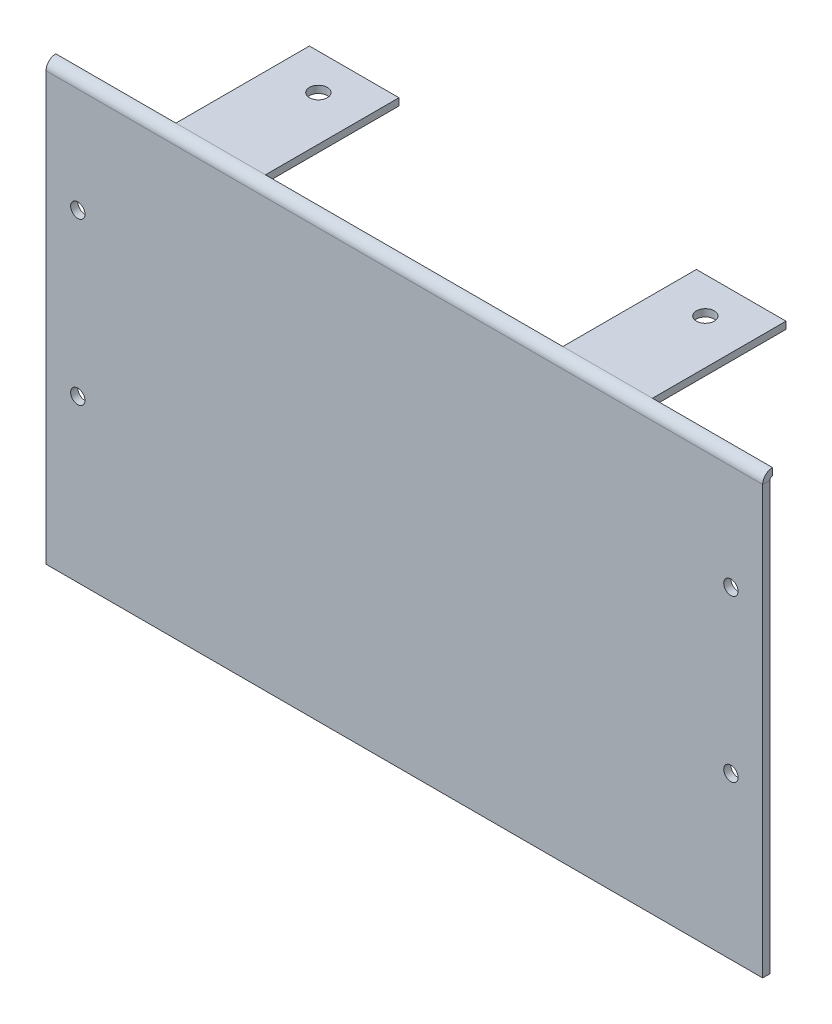
from build123d import *

# Parameters (mm, degrees)
SKETCH2_W                    = 200
SKETCH2_H                    = 120
BASE_FLANGE1_DEPTH           = 2
CUT_EXTRUDE1_REACH           = 235.247
SKETCH7_R                    = 2
EDGE_FLANGE1_STRIP_W         = 9.4732
EDGE_FLANGE1_STRIP_H         = 2
EDGE_FLANGE1_STRIP_CUT_DEPTH = 200
EDGE_FLANGE1_DEPTH           = 200
CUT_EXTRUDE2_REACH           = 239.664
SKETCH11_R                   = 2.5
SKETCH11_W                   = 33.5
SKETCH11_H                   = 37.2634
SKETCH11_W_2                 = 83


# Sheet-metal steps are written as plain solids
with BuildPart() as part:
    # Sketch2 → Base-Flange1 (new body)
    with BuildSketch(Plane.XY):
        with Locations((100, 60)):
            Rectangle(SKETCH2_W, SKETCH2_H)
    extrude(amount=-BASE_FLANGE1_DEPTH)

    # Sketch7 → Cut-Extrude1 (cut, up to next)
    with BuildSketch(Plane.XY, mode=Mode.PRIVATE) as cut_extrude1_sk1:
        with Locations((8.87, 90)):
            Circle(SKETCH7_R)
    cut_extrude1_tool1 = extrude(cut_extrude1_sk1.sketch, amount=-CUT_EXTRUDE1_REACH, mode=Mode.PRIVATE) & part.part
    # Sketch7 → Cut-Extrude1 (cut, up to next)
    with BuildSketch(Plane.XY, mode=Mode.PRIVATE) as cut_extrude1_sk2:
        with Locations((8.87, 45)):
            Circle(SKETCH7_R)
    cut_extrude1_tool2 = extrude(cut_extrude1_sk2.sketch, amount=-CUT_EXTRUDE1_REACH, mode=Mode.PRIVATE) & part.part
    # Sketch7 → Cut-Extrude1 (cut, up to next)
    with BuildSketch(Plane.XY, mode=Mode.PRIVATE) as cut_extrude1_sk3:
        with Locations((191.13, 45)):
            Circle(SKETCH7_R)
    cut_extrude1_tool3 = extrude(cut_extrude1_sk3.sketch, amount=-CUT_EXTRUDE1_REACH, mode=Mode.PRIVATE) & part.part
    # Sketch7 → Cut-Extrude1 (cut, up to next)
    with BuildSketch(Plane.XY, mode=Mode.PRIVATE) as cut_extrude1_sk4:
        with Locations((191.13, 90)):
            Circle(SKETCH7_R)
    cut_extrude1_tool4 = extrude(cut_extrude1_sk4.sketch, amount=-CUT_EXTRUDE1_REACH, mode=Mode.PRIVATE) & part.part
    add(cut_extrude1_tool1.solids().sort_by_distance((8.87, 90, 0))[0], mode=Mode.SUBTRACT)
    add(cut_extrude1_tool2.solids().sort_by_distance((8.87, 45, 0))[0], mode=Mode.SUBTRACT)
    add(cut_extrude1_tool3.solids().sort_by_distance((191.13, 45, 0))[0], mode=Mode.SUBTRACT)
    add(cut_extrude1_tool4.solids().sort_by_distance((191.13, 90, 0))[0], mode=Mode.SUBTRACT)

    # Edge-Flange1 strip (across the edge) → Edge-Flange1 strip cut (cut)
    with BuildSketch(Plane(origin=(0, 120, -2), x_dir=(0, -1, 0), z_dir=(1, 0, 0))):
        with Locations((-4, -1)):
            Rectangle(EDGE_FLANGE1_STRIP_W, EDGE_FLANGE1_STRIP_H)
    extrude(amount=EDGE_FLANGE1_STRIP_CUT_DEPTH, mode=Mode.SUBTRACT)

    # Edge-Flange1 section (across the edge) → Edge-Flange1 (add)
    with BuildSketch(Plane(origin=(0, 120, -2), x_dir=(0, -1, 0), z_dir=(1, 0, 0))):
        with BuildLine():
            Line((-2, 0.7366), (-2, 38))
            Line((-2, 38), (0, 38))
            Line((0, 38), (0, 0.7366))
            ThreePointArc((0, 0.7366), (0.215745145, 0.215745145), (0.7366, 0))
            Line((0.7366, 0), (0.7366, -2))
            ThreePointArc((0.7366, -2), (-1.198468417, -1.198468417), (-2, 0.7366))
        make_face()
    extrude(amount=EDGE_FLANGE1_DEPTH)

    # Sketch11 → Cut-Extrude2 (cut, up to next)
    with BuildSketch(Plane(origin=(0, 122, 0), x_dir=(1, 0, 0), z_dir=(0, 1, 0)), mode=Mode.PRIVATE) as cut_extrude2_sk1:
        with Locations(Location((154, 30, 0), (0, 0, 270))):
            Circle(SKETCH11_R)
    cut_extrude2_tool1 = extrude(cut_extrude2_sk1.sketch, amount=-CUT_EXTRUDE2_REACH, mode=Mode.PRIVATE) & part.part
    # Sketch11 → Cut-Extrude2 (cut, up to next)
    with BuildSketch(Plane(origin=(0, 122, 0), x_dir=(1, 0, 0), z_dir=(0, 1, 0)), mode=Mode.PRIVATE) as cut_extrude2_sk2:
        with Locations(Location((46, 30, 0), (0, 0, 270))):
            Circle(SKETCH11_R)
    cut_extrude2_tool2 = extrude(cut_extrude2_sk2.sketch, amount=-CUT_EXTRUDE2_REACH, mode=Mode.PRIVATE) & part.part
    # Sketch11 → Cut-Extrude2 (cut, up to next)
    with BuildSketch(Plane(origin=(0, 122, 0), x_dir=(1, 0, 0), z_dir=(0, 1, 0)), mode=Mode.PRIVATE) as cut_extrude2_sk3:
        with Locations((183.25, 21.3683)):
            Rectangle(SKETCH11_W, SKETCH11_H)
    cut_extrude2_tool3 = extrude(cut_extrude2_sk3.sketch, amount=-CUT_EXTRUDE2_REACH, mode=Mode.PRIVATE) & part.part
    # Sketch11 → Cut-Extrude2 (cut, up to next)
    with BuildSketch(Plane(origin=(0, 122, 0), x_dir=(1, 0, 0), z_dir=(0, 1, 0)), mode=Mode.PRIVATE) as cut_extrude2_sk4:
        with Locations((100, 21.3683)):
            Rectangle(SKETCH11_W_2, SKETCH11_H)
    cut_extrude2_tool4 = extrude(cut_extrude2_sk4.sketch, amount=-CUT_EXTRUDE2_REACH, mode=Mode.PRIVATE) & part.part
    # Sketch11 → Cut-Extrude2 (cut, up to next)
    with BuildSketch(Plane(origin=(0, 122, 0), x_dir=(1, 0, 0), z_dir=(0, 1, 0)), mode=Mode.PRIVATE) as cut_extrude2_sk5:
        with Locations((16.75, 21.3683)):
            Rectangle(SKETCH11_W, SKETCH11_H)
    cut_extrude2_tool5 = extrude(cut_extrude2_sk5.sketch, amount=-CUT_EXTRUDE2_REACH, mode=Mode.PRIVATE) & part.part
    add(cut_extrude2_tool1.solids().sort_by_distance((154, 122, -30))[0], mode=Mode.SUBTRACT)
    add(cut_extrude2_tool2.solids().sort_by_distance((46, 122, -30))[0], mode=Mode.SUBTRACT)
    add(cut_extrude2_tool3.solids().sort_by_distance((183.25, 122, -21.3683))[0], mode=Mode.SUBTRACT)
    add(cut_extrude2_tool4.solids().sort_by_distance((100, 122, -21.3683))[0], mode=Mode.SUBTRACT)
    add(cut_extrude2_tool5.solids().sort_by_distance((16.75, 122, -21.3683))[0], mode=Mode.SUBTRACT)


solid = part.part
